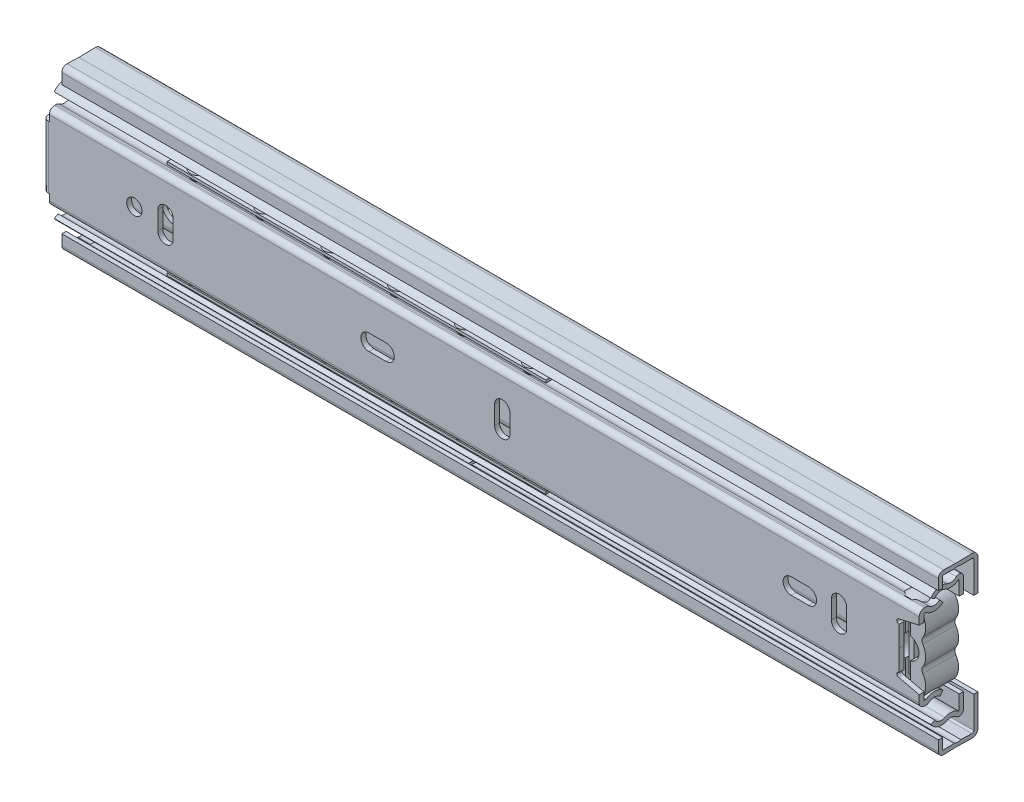
from build123d import *
from build123d.topology import SkipClean

# Parameters (mm, degrees)
EXTRUDE1_DEPTH      = 124.968
MIDDLE_MEMBER_DEPTH = 249.936
DRAWER_START        = -249.936
DRAWER_MEMBER_DEPTH = 249.936
SKETCH6_W           = 1.905
SKETCH6_H           = 12.147486483
CUT_EXTRUDE1_DEPTH  = 132.648607528
EXTRUDE4_DEPTH      = 8.89
CUT_EXTRUDE2_DEPTH  = 1.1938
SKETCH9_W           = 1.397
SKETCH9_H           = 7.493000005
EXTRUDE5_DEPTH      = 8.89
EXTRUDE6_DEPTH      = 1.016
EXTRUDE6_DEPTH_BACK = 8.382
CUT_EXTRUDE3_DEPTH  = 1.397
CUT_EXTRUDE4_DEPTH  = 132.215269917
CUT_EXTRUDE5_DEPTH  = 1.1938
CUT_EXTRUDE14_DEPTH = 1.1938
CUT_EXTRUDE15_DEPTH = 1.1938
SKETCH24_R          = 2.1844
CUT_EXTRUDE13_DEPTH = 1.397
CUT_E_DEPTH         = 1.397
CUT_EXTRUDE17_DEPTH = 1.2192
LPATTERN1_COUNT     = 6
LPATTERN1_PITCH     = 19.05
EXTRUDE7_DEPTH      = 6.35
EXTRUDE7_DEPTH_BACK = 101.6
SKETCH28_W          = 7.62
SKETCH28_H          = 0.762
LPATTERN2_COUNT     = 6
LPATTERN2_PITCH     = 19.05
EXTRUDE8_DEPTH      = 6.35
EXTRUDE8_DEPTH_BACK = 101.6
SKETCH30_W          = 5.08
SKETCH30_H          = 0.762


# Read off the part's stored shape, not the designer's step: Drawer Member
with BuildPart() as part:
    # Sketch1 → Extrude1 (new, symmetric)
    with BuildSketch(Plane(origin=(0, 0, 0), x_dir=(0, 0, -1), z_dir=(1, 0, 0))):
        with BuildLine():
            Line((-4.139279899, 22.8203125), (-0.743323143, 22.698920454))
            Line((-0.743323143, 22.698920454), (3.892452069, 22.8203125))
            ThreePointArc((3.892452069, 22.8203125), (5.124499805, 22.338098312), (5.6388, 21.119095664))
            Line((5.6388, 21.119095664), (5.6388, 0))
            Line((5.6388, 0), (4.445, 0))
            Line((4.445, 0), (4.445, 21.119095664))
            ThreePointArc((4.445, 21.119095664), (4.291477554, 21.482977052), (3.92370211, 21.626921585))
            Line((3.92370211, 21.626921585), (0.761857041, 21.544125758))
            ThreePointArc((0.761857041, 21.544125758), (-0.187154328, 21.71413397), (-1.131158407, 21.51822157))
            Line((-1.131158407, 21.51822157), (-4.181926298, 21.627274477))
            ThreePointArc((-4.181926298, 21.627274477), (-4.367367911, 21.55622161), (-4.445, 21.3734366))
            Line((-4.445, 21.3734366), (-4.445, 18.415))
            Line((-4.445, 18.415), (-5.6388, 18.415))
            Line((-5.6388, 18.415), (-5.6388, 21.3734366))
            ThreePointArc((-5.6388, 21.3734366), (-5.19629709, 22.415311161), (-4.139279899, 22.8203125))
        make_face()
    extrude(amount=EXTRUDE1_DEPTH, both=True)

    # Sketch8 → Cut-Extrude2 (cut)
    with BuildSketch(Plane.XY.offset(-4.445)):
        with BuildLine():
            Line((115.329533997, 7.645578895), (116.7638, 7.493000005))
            Line((116.7638, 7.493000005), (116.7638, 0))
            Line((116.7638, 0), (124.968, 0))
            Line((124.968, 0), (124.968, 12.204752384))
            Line((124.968, 12.204752384), (115.571356843, 12.204752384))
            ThreePointArc((115.571356843, 12.204752384), (113.288565723, 10.03983377), (115.329533997, 7.645578895))
        make_face()
    extrude(amount=-CUT_EXTRUDE2_DEPTH, mode=Mode.SUBTRACT)

    # Sketch9 → Extrude5 (add)
    with BuildSketch(Plane.XY.offset(-4.445)):
        with Locations((116.0653, 3.746500003)):
            Rectangle(SKETCH9_W, SKETCH9_H)
    extrude(amount=EXTRUDE5_DEPTH)

    # Sketch13 → Cut-Extrude5 (cut)
    with BuildSketch(Plane.XY.offset(-4.445)):
        with BuildLine():
            Line((-56.579699917, 7.112000069), (-81.408199931, 7.112000069))
            ThreePointArc((-81.408199931, 7.112000069), (-81.947015347, 6.888815416), (-82.1702, 6.35))
            Line((-82.1702, 6.35), (-82.1702, 0))
            Line((-82.1702, 0), (-84.4562, 0))
            Line((-84.4562, 0), (-84.4562, 6.35))
            ThreePointArc((-84.4562, 6.35), (-84.679384653, 6.888815416), (-85.218200069, 7.112000069))
            Line((-85.218200069, 7.112000069), (-107.506699917, 7.112000069))
            ThreePointArc((-107.506699917, 7.112000069), (-109.094199917, 8.699500069), (-107.506699917, 10.287000069))
            Line((-107.506699917, 10.287000069), (-56.579699917, 10.287000069))
            ThreePointArc((-56.579699917, 10.287000069), (-54.992199917, 8.699500069), (-56.579699917, 7.112000069))
        make_face()
        with BuildLine():
            Line((-62.193099917, 2.286), (-67.146099917, 2.286))
            ThreePointArc((-67.146099917, 2.286), (-68.762546018, 1.616446102), (-69.432099917, 0))
            Line((-69.432099917, 0), (-59.907099917, 0))
            ThreePointArc((-59.907099917, 0), (-60.576653815, 1.616446102), (-62.193099917, 2.286))
        make_face()
        with BuildLine():
            Line((-101.245599917, 0), (-96.673599917, 0))
            ThreePointArc((-96.673599917, 0), (-98.959599917, 2.286), (-101.245599917, 0))
        make_face()
        with BuildLine():
            Line((-93.143000083, 0), (-86.792999917, 0))
            ThreePointArc((-86.792999917, 0), (-89.968, 3.175000083), (-93.143000083, 0))
        make_face()
        with BuildLine():
            Line((-79.655599917, 0), (-75.083599917, 0))
            ThreePointArc((-75.083599917, 0), (-77.369599917, 2.286), (-79.655599917, 0))
        make_face()
    extrude(amount=-CUT_EXTRUDE5_DEPTH, mode=Mode.SUBTRACT)

    # Sketch32 → Cut-Extrude14 (cut)
    with BuildSketch(Plane(origin=(0, 0, -5.6388), x_dir=(-1, 0, 0), z_dir=(0, 0, -1))):
        with BuildLine():
            Line((-55.4945, 0), (-45.9695, 0))
            ThreePointArc((-45.9695, 0), (-46.639053898, 1.616446102), (-48.2555, 2.286))
            Line((-48.2555, 2.286), (-53.2085, 2.286))
            ThreePointArc((-53.2085, 2.286), (-54.824946102, 1.616446102), (-55.4945, 0))
        make_face()
        with BuildLine():
            Line((-41.207, 0), (-34.857, 0))
            ThreePointArc((-34.857, 0), (-38.032, 3.175), (-41.207, 0))
        make_face()
        with BuildLine():
            Line((-31.3645, 0), (-21.8395, 0))
            ThreePointArc((-21.8395, 0), (-22.509053898, 1.616446102), (-24.1255, 2.286))
            Line((-24.1255, 2.286), (-29.0785, 2.286))
            ThreePointArc((-29.0785, 2.286), (-30.694946102, 1.616446102), (-31.3645, 0))
        make_face()
        with BuildLine():
            Line((-18.474, 0), (-13.902, 0))
            Line((-13.902, 0), (-13.902, 8.763000069))
            ThreePointArc((-13.902, 8.763000069), (-14.348369265, 9.840630803), (-15.426, 10.287000069))
            Line((-15.426, 10.287000069), (-58.6695, 10.287000069))
            ThreePointArc((-58.6695, 10.287000069), (-60.257, 8.699500069), (-58.6695, 7.112000069))
            Line((-58.6695, 7.112000069), (-19.998, 7.112000069))
            ThreePointArc((-19.998, 7.112000069), (-18.920369265, 6.665630803), (-18.474, 5.588000069))
            Line((-18.474, 5.588000069), (-18.474, 0))
        make_face()
    extrude(amount=-CUT_EXTRUDE14_DEPTH, mode=Mode.SUBTRACT)

    # Sketch31 → Cut-Extrude15 (cut)
    with BuildSketch(Plane(origin=(0, 0, -5.6388), x_dir=(-1, 0, 0), z_dir=(0, 0, -1))):
        with BuildLine():
            Line((-109.093, 0), (-102.743, 0))
            ThreePointArc((-102.743, 0), (-105.918, 3.175), (-109.093, 0))
        make_face()
    extrude(amount=-CUT_EXTRUDE15_DEPTH, mode=Mode.SUBTRACT)

    # Mirror3 4: part across plane


with BuildPart() as body_2:
    # Sketch2 → Middle Member (new body)
    with BuildSketch(Plane.ZY.offset(127)):
        with BuildLine():
            ThreePointArc((5.7404, 15.627692517), (3.735864231, 17.127444277), (1.241474216, 16.914283663))
            ThreePointArc((1.241474216, 16.914283663), (-0.188944013, 16.688900955), (-1.505642365, 17.291560999))
            ThreePointArc((-1.505642365, 17.291560999), (-2.813430342, 17.487614783), (-3.53059999, 16.376572852))
            Line((-3.53059999, 16.376572852), (-3.53059999, 9.521737984))
            ThreePointArc((-3.53059999, 9.521737984), (-3.220327109, 8.457239952), (-2.386691239, 7.726160915))
            Line((-2.386691239, 7.726160915), (-0.414564934, 6.806543316))
            ThreePointArc((-0.414564934, 6.806543316), (-0.093935732, 6.525359052), (0.0254, 6.115936705))
            Line((0.0254, 6.115936705), (0.0254, 0))
            Line((0.0254, 0), (1.2446, 0))
            Line((1.2446, 0), (1.2446, 6.115936705))
            ThreePointArc((1.2446, 6.115936705), (0.934327119, 7.180434735), (0.100691251, 7.91151377))
            Line((0.100691251, 7.91151377), (-1.871435054, 8.831131369))
            ThreePointArc((-1.871435054, 8.831131369), (-2.192064258, 9.112315634), (-2.31139999, 9.521737984))
            Line((-2.31139999, 9.521737984), (-2.31139999, 16.376572852))
            ThreePointArc((-2.31139999, 16.376572852), (-2.311399987, 16.376572856), (-2.311399982, 16.376572855))
            ThreePointArc((-2.311399982, 16.376572855), (-0.35482671, 15.481038557), (1.770730805, 15.815950333))
            ThreePointArc((1.770730805, 15.815950333), (3.400639083, 15.955235789), (4.710462095, 14.975253591))
            Line((4.710462095, 14.975253591), (5.7404, 15.627692517))
        make_face()
    extrude(amount=-MIDDLE_MEMBER_DEPTH)

    # Sketch12 → Cut-Extrude4 (cut, through all)
    with BuildSketch(Plane.XY.offset(1.2446)):
        with BuildLine():
            Line((122.936, 12.065), (112.776, 12.065))
            ThreePointArc((112.776, 12.065), (110.979948776, 11.321051224), (110.236, 9.525))
            Line((110.236, 9.525), (110.236, 0))
            Line((110.236, 0), (122.936, 0))
            Line((122.936, 0), (122.936, 12.065))
        make_face()
    extrude(amount=-CUT_EXTRUDE4_DEPTH, mode=Mode.SUBTRACT)

    # Sketch26 → Cut-Extrude17 (cut)
    with BuildSketch(Plane.XY.offset(1.2446)):
        with BuildLine():
            Line((-101.245599917, 0), (-59.907099917, 0))
            ThreePointArc((-59.907099917, 0), (-61.320602591, 3.412497326), (-64.733099917, 4.826))
            Line((-64.733099917, 4.826), (-96.419599917, 4.826))
            ThreePointArc((-96.419599917, 4.826), (-99.832097243, 3.412497326), (-101.245599917, 0))
        make_face()
        with BuildLine():
            Line((55.4945, 0), (21.8395, 0))
            ThreePointArc((21.8395, 0), (23.253002674, 3.412497326), (26.6655, 4.826))
            Line((26.6655, 4.826), (50.6685, 4.826))
            ThreePointArc((50.6685, 4.826), (54.080997326, 3.412497326), (55.4945, 0))
        make_face()
    extrude(amount=-CUT_EXTRUDE17_DEPTH, mode=Mode.SUBTRACT)

    # Mirror3 3: body 2 across plane


with BuildPart() as body_3:
    # Drawer Member outline → Drawer Member (new body)
    with BuildSketch(Plane.ZY.offset(129.032).offset(DRAWER_START)):
        with BuildLine():
            Line((5.6642, 0), (7.0612, 0))
            Line((7.0612, 0), (7.0612, 10.623486483))
            ThreePointArc((7.0612, 10.623486483), (6.614830734, 11.701117218), (5.5372, 12.147486483))
            Line((5.5372, 12.147486483), (5.164341455, 12.147486483))
            ThreePointArc((5.164341455, 12.147486483), (4.67440708, 12.066587417), (4.236487447, 11.83247901))
            ThreePointArc((4.236487447, 11.83247901), (2.709144677, 11.334862777), (1.208194452, 11.907179363))
            Line((1.208194452, 11.907179363), (0.304054167, 10.842219578))
            ThreePointArc((0.304054167, 10.842219578), (2.674694689, 9.938287609), (5.087020295, 10.724235863))
            ThreePointArc((5.087020295, 10.724235863), (5.123513594, 10.743744895), (5.164341455, 10.750486483))
            Line((5.164341455, 10.750486483), (5.5372, 10.750486483))
            ThreePointArc((5.5372, 10.750486483), (5.627002561, 10.713289044), (5.6642, 10.623486483))
            Line((5.6642, 10.623486483), (5.6642, 0))
        make_face()
    extrude(amount=DRAWER_MEMBER_DEPTH)

    # Sketch6 → Cut-Extrude1 (cut, through all)
    with BuildSketch(Plane.XY.offset(7.0612)):
        with Locations((-128.0795, 6.073743242)):
            Rectangle(SKETCH6_W, SKETCH6_H)
    extrude(amount=-CUT_EXTRUDE1_DEPTH, mode=Mode.SUBTRACT)

    # Sketch7 → Extrude4 (add)
    with BuildSketch(Plane.XZ):
        with BuildLine():
            Line((-127.127, 7.0612), (-127.381, 7.0612))
            ThreePointArc((-127.381, 7.0612), (-128.548433296, 6.577633296), (-129.032, 5.4102))
            Line((-129.032, 5.4102), (-129.032, 0.304054167))
            Line((-129.032, 0.304054167), (-127.635, 0.304054167))
            Line((-127.635, 0.304054167), (-127.635, 5.4102))
            ThreePointArc((-127.635, 5.4102), (-127.560605122, 5.589805122), (-127.381, 5.6642))
            Line((-127.381, 5.6642), (-127.127, 5.6642))
            Line((-127.127, 5.6642), (-127.127, 7.0612))
        make_face()
    extrude(amount=-EXTRUDE4_DEPTH)

    # Sketch11 → Cut-Extrude3 (cut)
    with BuildSketch(Plane.XY.offset(7.0612)):
        with BuildLine():
            Line((115.189048602, 5.967847879), (115.189, 0))
            Line((115.189, 0), (120.904, 0))
            Line((120.904, 0), (120.904, 8.589285844))
            Line((120.904, 8.589285844), (115.044673543, 7.221216084))
            ThreePointArc((115.044673543, 7.221216084), (114.558225152, 6.530182899), (115.189048602, 5.967847879))
        make_face()
    extrude(amount=-CUT_EXTRUDE3_DEPTH, mode=Mode.SUBTRACT)

    # Sketch24 → Cut-Extrude13 (cut)
    with BuildSketch(Plane.XY.offset(7.0612)):
        with Locations((-102.87, 0)):
            Circle(SKETCH24_R)
        with BuildLine():
            Line((-96.1644, 2.6416), (-96.1644, 0))
            Line((-96.1644, 0), (-91.7956, 0))
            Line((-91.7956, 0), (-91.7956, 2.6416))
            ThreePointArc((-91.7956, 2.6416), (-93.98, 4.826), (-96.1644, 2.6416))
        make_face()
        with BuildLine():
            Line((-38.2905, 0), (-28.7655, 0))
            ThreePointArc((-28.7655, 0), (-29.435053898, 1.616446102), (-31.0515, 2.286))
            Line((-31.0515, 2.286), (-36.0045, 2.286))
            ThreePointArc((-36.0045, 2.286), (-37.620946102, 1.616446102), (-38.2905, 0))
        make_face()
        with BuildLine():
            Line((-0.1524, 2.6416), (-0.1524, 0))
            Line((-0.1524, 0), (4.2164, 0))
            Line((4.2164, 0), (4.2164, 2.6416))
            ThreePointArc((4.2164, 2.6416), (2.032, 4.826), (-0.1524, 2.6416))
        make_face()
    extrude(amount=-CUT_EXTRUDE13_DEPTH, mode=Mode.SUBTRACT)

    # Sketch25 → Cut E (cut)
    with BuildSketch(Plane.XY.offset(7.0612)):
        with BuildLine():
            Line((95.8596, 0), (100.2284, 0))
            Line((100.2284, 0), (100.2284, 2.6416))
            ThreePointArc((100.2284, 2.6416), (98.044, 4.826), (95.8596, 2.6416))
            Line((95.8596, 2.6416), (95.8596, 0))
        make_face()
        with BuildLine():
            Line((91.6305, 0), (82.1055, 0))
            ThreePointArc((82.1055, 0), (82.775053898, 1.616446102), (84.3915, 2.286))
            Line((84.3915, 2.286), (89.3445, 2.286))
            ThreePointArc((89.3445, 2.286), (90.960946102, 1.616446102), (91.6305, 0))
        make_face()
    extrude(amount=-CUT_E_DEPTH, mode=Mode.SUBTRACT)

    # Mirror3 2: body 3 across plane


with BuildPart() as body_4:
    # Sketch10 → Extrude6 (new, two sides: drawn at the far end of the back side and taken through both)
    with BuildSketch(Plane.XY.offset(4.445).offset(-EXTRUDE6_DEPTH_BACK)):
        with BuildLine():
            Line((110.9853, 0), (112.8903, 0))
            ThreePointArc((112.8903, 0), (113.58046946, 1.976421561), (115.350925, 3.093589074))
            Line((115.350925, 3.093589074), (115.350925, 9.8425))
            Line((115.350925, 9.8425), (116.779675, 9.8425))
            Line((116.779675, 9.8425), (116.779675, 3.093589074))
            ThreePointArc((116.779675, 3.093589074), (118.55013054, 1.976421561), (119.2403, 0))
            Line((119.2403, 0), (121.1453, 0))
            ThreePointArc((121.1453, 0), (120.938650432, 1.434174174), (120.335514345, 2.751666667))
            ThreePointArc((120.335514345, 2.751666667), (120.082456328, 3.6115625), (120.335514345, 4.471458333))
            ThreePointArc((120.335514345, 4.471458333), (116.0653, 12.303125), (111.795085655, 4.471458333))
            ThreePointArc((111.795085655, 4.471458333), (112.048143672, 3.6115625), (111.795085655, 2.751666667))
            ThreePointArc((111.795085655, 2.751666667), (111.191949568, 1.434174174), (110.9853, 0))
        make_face()
    extrude(amount=EXTRUDE6_DEPTH + EXTRUDE6_DEPTH_BACK)

    # Mirror3: body 4 across plane


with BuildPart() as body_5:
    # Sketch27 → Revolve1 (revolve)
    with BuildSketch(Plane.ZY.offset(112.268)):
        with BuildLine():
            Line((0.1524, 21.683172421), (0.1524, 16.665571078))
            ThreePointArc((0.1524, 16.665571078), (2.661200671, 19.174371749), (0.1524, 21.683172421))
        make_face()
    revolve(axis=Axis((-112.268, 23.635004298, 0.1524), (0, -1, 0)))


with BuildPart() as lpattern1_1:
    # LPattern1: pattern copy
    add(body_5.part.moved(Location(Vector(1, 0, 0) * (1 * LPATTERN1_PITCH))))


with BuildPart() as lpattern1_2:
    # LPattern1: pattern copy
    add(body_5.part.moved(Location(Vector(1, 0, 0) * (2 * LPATTERN1_PITCH))))


with BuildPart() as lpattern1_3:
    # LPattern1: pattern copy
    add(body_5.part.moved(Location(Vector(1, 0, 0) * (3 * LPATTERN1_PITCH))))


with BuildPart() as lpattern1_4:
    # LPattern1: pattern copy
    add(body_5.part.moved(Location(Vector(1, 0, 0) * (4 * LPATTERN1_PITCH))))


with BuildPart() as lpattern1_5:
    # LPattern1: pattern copy
    add(body_5.part.moved(Location(Vector(1, 0, 0) * (5 * LPATTERN1_PITCH))))


with BuildPart() as body_5_1:
    add(body_5.part)

    add(lpattern1_1.part)  # Extrude7 merges LPattern1_1

    add(lpattern1_2.part)  # Extrude7 merges LPattern1_2

    add(lpattern1_3.part)  # Extrude7 merges LPattern1_3

    add(lpattern1_4.part)  # Extrude7 merges LPattern1_4

    add(lpattern1_5.part)  # Extrude7 merges LPattern1_5
    # Sketch28 → Extrude7 (add, two sides: drawn at the far end of the back side and taken through both)
    with BuildSketch(Plane.ZY.offset(112.268).offset(-EXTRUDE7_DEPTH_BACK)):
        with Locations((0.1524, 19.174371749)):
            Rectangle(SKETCH28_W, SKETCH28_H)
    extrude(amount=EXTRUDE7_DEPTH + EXTRUDE7_DEPTH_BACK)


with BuildPart() as body_6:
    # Sketch29 → Revolve2 (revolve)
    with BuildSketch(Plane.ZY.offset(88.9)):
        with BuildLine():
            Line((2.7686, 16.043834368), (2.7686, 11.446434358))
            ThreePointArc((2.7686, 11.446434358), (5.067300005, 13.745134363), (2.7686, 16.043834368))
        make_face()
    revolve(axis=Axis((-88.9, 16.680143034, 2.7686), (0, -1, 0)))


with BuildPart() as lpattern2_1:
    # LPattern2: pattern copy
    add(body_6.part.moved(Location(Vector(1, 0, 0) * (1 * LPATTERN2_PITCH))))


with BuildPart() as lpattern2_2:
    # LPattern2: pattern copy
    add(body_6.part.moved(Location(Vector(1, 0, 0) * (2 * LPATTERN2_PITCH))))


with BuildPart() as lpattern2_3:
    # LPattern2: pattern copy
    add(body_6.part.moved(Location(Vector(1, 0, 0) * (3 * LPATTERN2_PITCH))))


with BuildPart() as lpattern2_4:
    # LPattern2: pattern copy
    add(body_6.part.moved(Location(Vector(1, 0, 0) * (4 * LPATTERN2_PITCH))))


with BuildPart() as lpattern2_5:
    # LPattern2: pattern copy
    add(body_6.part.moved(Location(Vector(1, 0, 0) * (5 * LPATTERN2_PITCH))))


with BuildPart() as body_6_1:
    add(body_6.part)

    add(lpattern2_1.part)  # Extrude8 merges LPattern2_1

    add(lpattern2_2.part)  # Extrude8 merges LPattern2_2

    add(lpattern2_3.part)  # Extrude8 merges LPattern2_3

    add(lpattern2_4.part)  # Extrude8 merges LPattern2_4

    add(lpattern2_5.part)  # Extrude8 merges LPattern2_5
    # Sketch30 → Extrude8 (add, two sides: drawn at the far end of the back side and taken through both)
    with BuildSketch(Plane.ZY.offset(88.9).offset(-EXTRUDE8_DEPTH_BACK)):
        with Locations((2.7686, 13.745134363)):
            Rectangle(SKETCH30_W, SKETCH30_H)
    extrude(amount=EXTRUDE8_DEPTH + EXTRUDE8_DEPTH_BACK)


with BuildPart() as body_4_1:
    add(body_4.part)
    add(body_4.part.mirror(Plane.ZX))


with BuildPart() as body_3_1:
    with SkipClean():  # the faces are left unmerged after this step: merging them gives an invalid solid
        add(body_3.part)
        add(body_3.part.mirror(Plane.ZX))


with BuildPart() as body_2_1:
    add(body_2.part)
    add(body_2.part.mirror(Plane.ZX))


with BuildPart() as part_1:
    with SkipClean():  # the faces are left unmerged after this step: merging them gives an invalid solid
        add(part.part)
        add(part.part.mirror(Plane.ZX))


with BuildPart() as body_7:
    # Mirror5: mirrored copy
    add(body_6_1.part.mirror(Plane.ZX))


with BuildPart() as body_8:
    # Mirror5 2: mirrored copy
    add(body_5_1.part.mirror(Plane.ZX))


solid = Compound([body_5_1.part, body_6_1.part, body_4_1.part, body_3_1.part, body_2_1.part, part_1.part, body_7.part, body_8.part])
